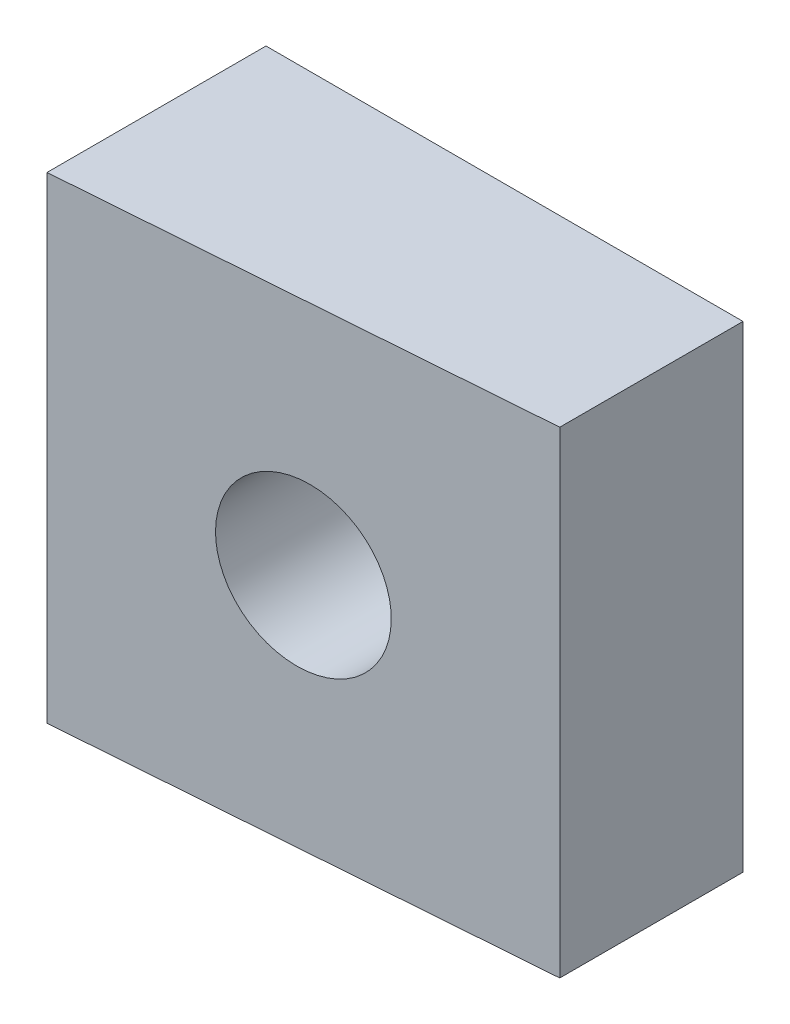
from build123d import *

# Parameters (mm, degrees)
BOSS_EXTRUDE1_DEPTH = 19.05
SKETCH3_R           = 3.2639
CUT_EXTRUDE2_DEPTH  = 29.325008162


# Read off the part's stored shape, not the designer's step: Boss-Extrude1
with BuildPart() as part:
    # Boss-Extrude1 outline → Boss-Extrude1 (new body)
    with BuildSketch(Plane(origin=(0, 0, 0), x_dir=(1, 0, 0), z_dir=(0, 1, 0))):
        Polygon((19.05, -7.317740003), (19.05, 0), (0, 0), (0, -8.746490003), align=None)
    extrude(amount=BOSS_EXTRUDE1_DEPTH)

    # Sketch3 → Cut-Extrude2 (cut, through all)
    with BuildSketch(Plane(origin=(0, 0, 0), x_dir=(-1, 0, 0), z_dir=(0, 0, -1))):
        with Locations((-9.525, 9.525)):
            Circle(SKETCH3_R)
    extrude(amount=-CUT_EXTRUDE2_DEPTH, mode=Mode.SUBTRACT)


solid = part.part
